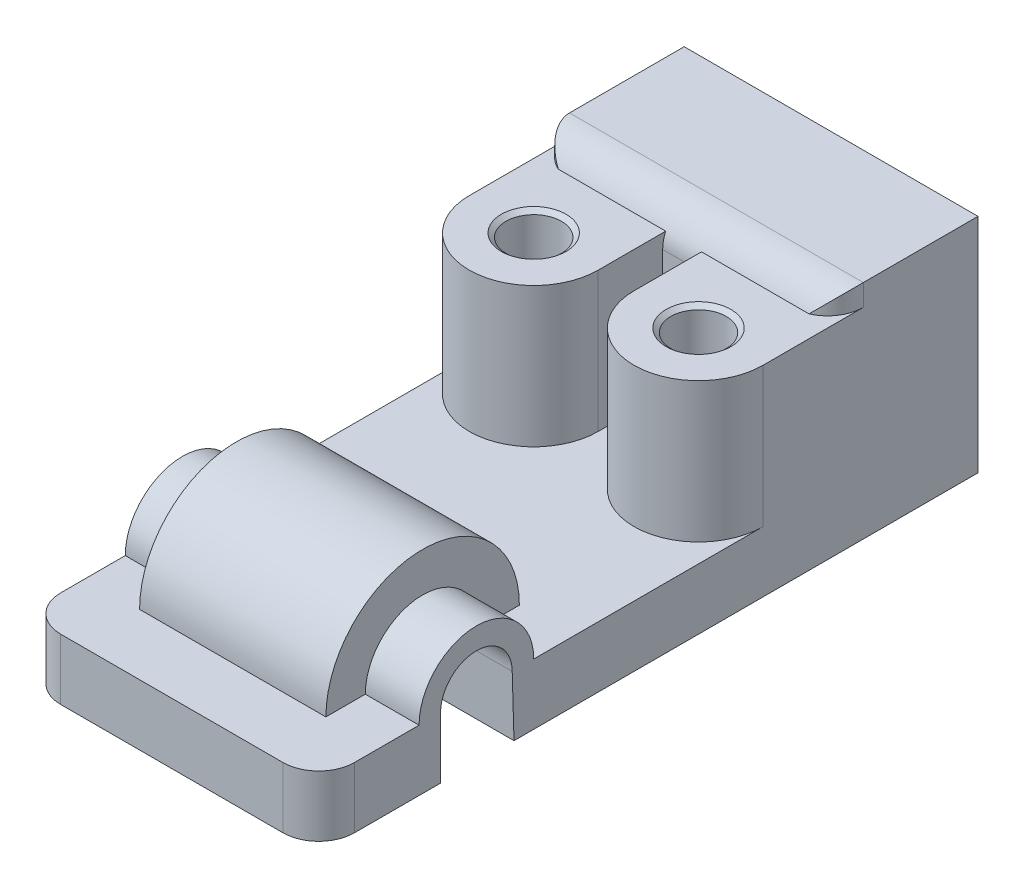
from build123d import *

# Parameters (mm, degrees)
BOSS_EXTRUDE2_DEPTH      = 41
BOSS_EXTRUDE4_DEPTH      = 39
BOSS_EXTRUDE6_DEPTH      = 41
BOSS_EXTRUDE6_DEPTH_BACK = 41
BOSS_EXTRUDE7_DEPTH      = 26
CUT_EXTRUDE1_DEPTH       = 211.770016843
CUT_EXTRUDE5_START       = -6
SKETCH12_W               = 66
SKETCH12_H               = 36
CUT_EXTRUDE5_DEPTH       = 50
FILLET1_R                = 10
SKETCH13_R               = 10
CUT_EXTRUDE6_DEPTH       = 50


with BuildPart() as part:
    # Sketch3 → Boss-Extrude2 (new, symmetric)
    with BuildSketch(Plane(origin=(0, 0, 0), x_dir=(0, 0, -1), z_dir=(1, 0, 0))):
        Polygon((0, 0), (184, 0), (184, 62), (142, 62), (142, 17), (0, 17), align=None)
    extrude(amount=BOSS_EXTRUDE2_DEPTH, both=True)

    # Sketch4 → Boss-Extrude4 (add)
    with BuildSketch(Plane(origin=(0, 17, 0), x_dir=(1, 0, 0), z_dir=(0, 1, 0))):
        with BuildLine():
            Line((41, 142), (41, 124))
            ThreePointArc((41, 124), (23, 106), (5, 124))
            Line((5, 124), (5, 142))
            Line((5, 142), (41, 142))
        make_face()
    boss_extrude4 = extrude(amount=BOSS_EXTRUDE4_DEPTH)

    # Sketch6 → M18 Tapped Hole1 (revolve, cut)
    with BuildSketch(Plane(origin=(23, 56, -124), x_dir=(0, 0, 1), z_dir=(1, 0, 0))):
        Polygon((0, 0), (0, 31.656669797), (7.75, 27), (7.75, 1.06985203), (9.025, 0), align=None)
    m18_tapped_hole1 = revolve(axis=Axis((23, 62.35, -124), (0, -1, 0)), mode=Mode.SUBTRACT)

    # Mirror1: Boss-Extrude4, M18 Tapped Hole1 across plane
    add(boss_extrude4.mirror(Plane(origin=(0, 0, 0), x_dir=(0, 0, 1), z_dir=(1, 0, 0))))
    add(m18_tapped_hole1.mirror(Plane(origin=(0, 0, 0), x_dir=(0, 0, 1), z_dir=(1, 0, 0))), mode=Mode.SUBTRACT)

    # Sketch10 → Boss-Extrude6 (add, two sides: drawn at the far end of the back side and taken through both)
    with BuildSketch(Plane(origin=(0, 0, 0), x_dir=(0, 0, -1), z_dir=(1, 0, 0)).offset(-BOSS_EXTRUDE6_DEPTH_BACK)):
        with BuildLine():
            ThreePointArc((60, 17), (44, 33), (28, 17))
            Line((28, 17), (34, 17))
            ThreePointArc((34, 17), (44, 27), (54, 17))
            Line((54, 17), (60, 17))
        make_face()
    extrude(amount=BOSS_EXTRUDE6_DEPTH + BOSS_EXTRUDE6_DEPTH_BACK)

    # Sketch10<3> → Boss-Extrude7 (add, symmetric)
    with BuildSketch(Plane(origin=(0, 0, 0), x_dir=(0, 0, -1), z_dir=(1, 0, 0))):
        with BuildLine():
            ThreePointArc((71, 17), (44, 44), (17, 17))
            Line((17, 17), (28, 17))
            ThreePointArc((28, 17), (44, 33), (60, 17))
            Line((60, 17), (71, 17))
        make_face()
    extrude(amount=BOSS_EXTRUDE7_DEPTH, both=True)

    # Sketch11 → Cut-Extrude1 (cut, through all)
    with BuildSketch(Plane(origin=(41, 0, 0), x_dir=(0, 0, -1), z_dir=(1, 0, 0))):
        Polygon((54, 17), (34, 17), (34, 0), (54.499323558, 0), align=None)
        with BuildLine():
            ThreePointArc((54, 17), (44, 26.710592894), (34, 17))
            Line((34, 17), (54, 17))
        make_face()
    extrude(amount=-CUT_EXTRUDE1_DEPTH, mode=Mode.SUBTRACT)

    # Sketch12 → Cut-Extrude5 (cut)
    with BuildSketch(Plane.XZ.offset(CUT_EXTRUDE5_START)):
        with Locations((0, -166)):
            Rectangle(SKETCH12_W, SKETCH12_H)
    extrude(amount=-CUT_EXTRUDE5_DEPTH, mode=Mode.SUBTRACT)

    # Fillet1
    # the kernel refuses this fillet: 10 mm, written as the material it takes off along each edge
    with BuildSketch(Plane(origin=(-66, 62, -142), x_dir=(0, -1, 0), z_dir=(1, 0, 0))) as fillet1_piece_1_section:
        with BuildLine():
            CenterArc((FILLET1_R, FILLET1_R), FILLET1_R, 180, 90)
            Line((0, FILLET1_R), (0, 0))
            Line((0, 0), (FILLET1_R, 0))
        make_face()
    fillet1_piece_1 = extrude(amount=132, mode=Mode.PRIVATE)
    fillet1_piece_1 = split(fillet1_piece_1, bisect_by=Plane(origin=(-35.5, 56, -144.437451755), z_dir=(0, 1, 0)), keep=Keep.TOP, mode=Mode.PRIVATE)
    fillet1_piece_1 = split(fillet1_piece_1, bisect_by=Plane(origin=(-5, 60.149499364, -144.437451755), z_dir=(-1, 0, 0)), keep=Keep.TOP, mode=Mode.PRIVATE)
    add(fillet1_piece_1, mode=Mode.SUBTRACT)
    with BuildSketch(Plane(origin=(-66, 62, -142), x_dir=(0, -1, 0), z_dir=(1, 0, 0))) as fillet1_piece_2_section:
        with BuildLine():
            CenterArc((FILLET1_R, FILLET1_R), FILLET1_R, 180, 90)
            Line((0, FILLET1_R), (0, 0))
            Line((0, 0), (FILLET1_R, 0))
        make_face()
    fillet1_piece_2 = extrude(amount=132, mode=Mode.PRIVATE)
    fillet1_piece_2 = split(fillet1_piece_2, bisect_by=Plane(origin=(0, 56, -142.10131848), z_dir=(0, -1, 0)), keep=Keep.TOP, mode=Mode.PRIVATE)
    fillet1_piece_2 = split(fillet1_piece_2, bisect_by=Plane(origin=(5, 54.582513339, -142.10131848), z_dir=(-1, 0, 0)), keep=Keep.TOP, mode=Mode.PRIVATE)
    fillet1_piece_2 = split(fillet1_piece_2, bisect_by=Plane(origin=(-5, 54.582513339, -142.10131848), z_dir=(1, 0, 0)), keep=Keep.TOP, mode=Mode.PRIVATE)
    add(fillet1_piece_2, mode=Mode.SUBTRACT)
    with BuildSketch(Plane(origin=(-66, 62, -142), x_dir=(0, -1, 0), z_dir=(1, 0, 0))) as fillet1_piece_3_section:
        with BuildLine():
            CenterArc((FILLET1_R, FILLET1_R), FILLET1_R, 180, 90)
            Line((0, FILLET1_R), (0, 0))
            Line((0, 0), (FILLET1_R, 0))
        make_face()
    fillet1_piece_3 = extrude(amount=132, mode=Mode.PRIVATE)
    fillet1_piece_3 = split(fillet1_piece_3, bisect_by=Plane(origin=(0, 56, -144.437451755), z_dir=(0, 1, 0)), keep=Keep.TOP, mode=Mode.PRIVATE)
    fillet1_piece_3 = split(fillet1_piece_3, bisect_by=Plane(origin=(5, 60.149499364, -144.437451755), z_dir=(-1, 0, 0)), keep=Keep.TOP, mode=Mode.PRIVATE)
    fillet1_piece_3 = split(fillet1_piece_3, bisect_by=Plane(origin=(-5, 60.149499364, -144.437451755), z_dir=(1, 0, 0)), keep=Keep.TOP, mode=Mode.PRIVATE)
    add(fillet1_piece_3, mode=Mode.SUBTRACT)
    with BuildSketch(Plane(origin=(-66, 62, -142), x_dir=(0, -1, 0), z_dir=(1, 0, 0))) as fillet1_piece_4_section:
        with BuildLine():
            CenterArc((FILLET1_R, FILLET1_R), FILLET1_R, 180, 90)
            Line((0, FILLET1_R), (0, 0))
            Line((0, 0), (FILLET1_R, 0))
        make_face()
    fillet1_piece_4 = extrude(amount=132, mode=Mode.PRIVATE)
    fillet1_piece_4 = split(fillet1_piece_4, bisect_by=Plane(origin=(35.5, 56, -144.437451755), z_dir=(0, 1, 0)), keep=Keep.TOP, mode=Mode.PRIVATE)
    fillet1_piece_4 = split(fillet1_piece_4, bisect_by=Plane(origin=(5, 60.149499364, -144.437451755), z_dir=(1, 0, 0)), keep=Keep.TOP, mode=Mode.PRIVATE)
    add(fillet1_piece_4, mode=Mode.SUBTRACT)
    with BuildSketch(Plane(origin=(41, 87, -142), x_dir=(0, 0, -1), z_dir=(0, -1, 0))) as fillet1_piece_5:
        with BuildLine():
            CenterArc((FILLET1_R, -FILLET1_R), FILLET1_R, 90, 90)
            Line((0, -FILLET1_R), (0, 0))
            Line((0, 0), (FILLET1_R, 0))
        make_face()
    extrude(amount=31, mode=Mode.SUBTRACT)
    with BuildSketch(Plane(origin=(-41, 87, -142), x_dir=(0, 0, -1), z_dir=(0, -1, 0))) as fillet1_piece_6:
        with BuildLine():
            CenterArc((FILLET1_R, FILLET1_R), FILLET1_R, 180, 90)
            Line((0, FILLET1_R), (0, 0))
            Line((0, 0), (FILLET1_R, 0))
        make_face()
    extrude(amount=31, mode=Mode.SUBTRACT)
    with BuildSketch(Plane(origin=(-41, 42, 0), x_dir=(1, 0, 0), z_dir=(0, -1, 0))) as fillet1_piece_7:
        with BuildLine():
            CenterArc((FILLET1_R, -FILLET1_R), FILLET1_R, 90, 90)
            Line((0, -FILLET1_R), (0, 0))
            Line((0, 0), (FILLET1_R, 0))
        make_face()
    extrude(amount=67, mode=Mode.SUBTRACT)
    with BuildSketch(Plane(origin=(41, 42, 0), x_dir=(-1, 0, 0), z_dir=(0, -1, 0))) as fillet1_piece_8:
        with BuildLine():
            CenterArc((FILLET1_R, FILLET1_R), FILLET1_R, 180, 90)
            Line((0, FILLET1_R), (0, 0))
            Line((0, 0), (FILLET1_R, 0))
        make_face()
    extrude(amount=67, mode=Mode.SUBTRACT)

    # Sketch13 → Cut-Extrude6 (cut)
    with BuildSketch(Plane.ZY.offset(41)):
        with Locations((-166, 47.190644355)):
            Circle(SKETCH13_R)
    extrude(amount=-CUT_EXTRUDE6_DEPTH, mode=Mode.SUBTRACT)


solid = part.part
